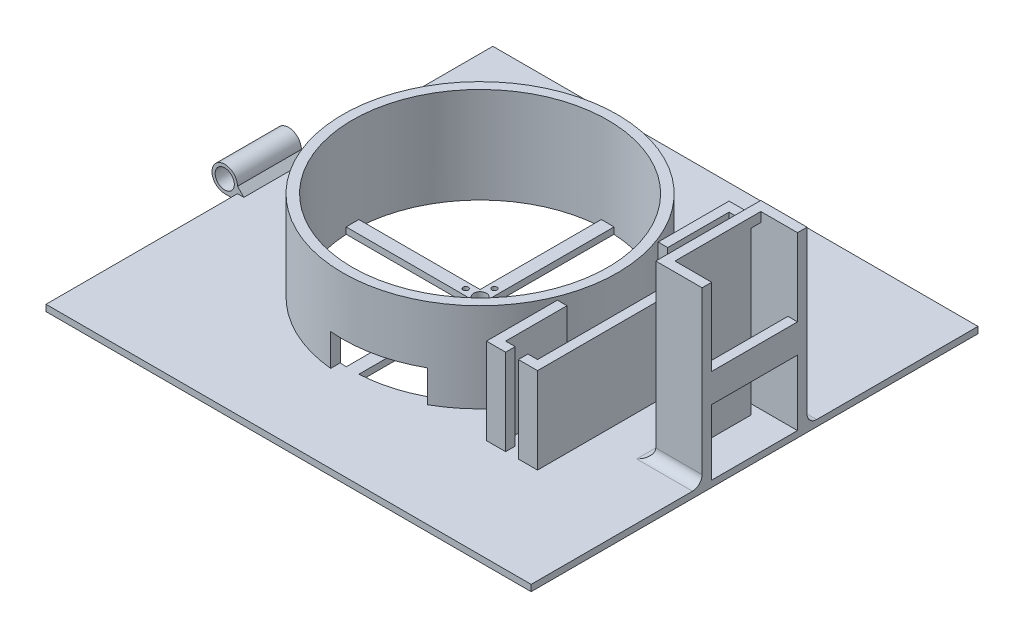
from build123d import *

# Parameters (mm, degrees)
CROQUIS1_R                 = 43
CROQUIS1_R_2               = 40
SALIENTE_EXTRUIR1_DEPTH    = 30
CROQUIS3_R                 = 0.81
CROQUIS3_R_2               = 2
SALIENTE_EXTRUIR2_DEPTH    = 2
CROQUIS4_W                 = 152
CROQUIS4_H                 = 140
CROQUIS4_R                 = 43
SALIENTE_EXTRUIR3_DEPTH    = 2
SALIENTE_EXTRUIR17_DEPTH   = 27
SALIENTE_EXTRUIR17_2_DEPTH = 27
SALIENTE_EXTRUIR17_3_DEPTH = 27
CORTAR_EXTRUIR1_REACH      = 169.021
CORTAR_EXTRUIR1_END_RADIUS = 40
CROQUIS15_W                = 25
CROQUIS15_H                = 10
SALIENTE_EXTRUIR19_START   = -60
CROQUIS18_R                = 4
CROQUIS18_R_2              = 3
SALIENTE_EXTRUIR19_DEPTH   = 20
CROQUIS19_W                = 14.5
CROQUIS19_H                = 3
CROQUIS19_W_2              = 3
CROQUIS19_H_2              = 20.9
SALIENTE_EXTRUIR20_DEPTH   = 53.7
SALIENTE_EXTRUIR21_REACH   = 134.145
CROQUIS20_W                = 3
CROQUIS20_H                = 3
CROQUIS20_H_2              = 9
SALIENTE_EXTRUIR22_START   = 23.9
CROQUIS20_2_W              = 3
CROQUIS20_2_H              = 3
SALIENTE_EXTRUIR22_DEPTH   = 3
REDONDEO1_R                = 3


with BuildPart() as part:
    # Croquis1 → Saliente-Extruir1 (new body)
    with BuildSketch(Plane(origin=(0, 0, 0), x_dir=(1, 0, 0), z_dir=(0, 1, 0))):
        with Locations(Location((0, 0, 0), (0, 0, 270))):
            Circle(CROQUIS1_R)
        with Locations(Location((0, 0, 0), (0, 0, 270))):
            Circle(CROQUIS1_R_2, mode=Mode.SUBTRACT)
    extrude(amount=SALIENTE_EXTRUIR1_DEPTH)

    # Croquis3 → Saliente-Extruir2 (add)
    with BuildSketch(Plane(origin=(0, 0, 0), x_dir=(1, 0, 0), z_dir=(0, 1, 0))):
        with BuildLine():
            Line((-2, 39.949968711), (-2, 2))
            Line((-2, 2), (-39.949968711, 2))
            ThreePointArc((-39.949968711, 2), (-40, 0), (-39.949968711, -2))
            Line((-39.949968711, -2), (-2, -2))
            Line((-2, -2), (-2, -39.949968711))
            ThreePointArc((-2, -39.949968711), (0, -40), (2, -39.949968711))
            Line((2, -39.949968711), (2, -2))
            Line((2, -2), (39.949968711, -2))
            ThreePointArc((39.949968711, -2), (39.987490222, -1.000312842), (40, 0))
            ThreePointArc((40, 0), (39.987490222, 1.000312842), (39.949968711, 2))
            Line((39.949968711, 2), (2, 2))
            Line((2, 2), (2, 39.949968711))
            ThreePointArc((2, 39.949968711), (0, 40), (-2, 39.949968711))
        make_face()
        with Locations(Location((0, -4.5, 0), (0, 0, 270))):
            Circle(CROQUIS3_R, mode=Mode.SUBTRACT)
        with Locations(Location((-4.5, 0, 0), (0, 0, 270))):
            Circle(CROQUIS3_R, mode=Mode.SUBTRACT)
        with Locations(Location((0, 0, 0), (0, 0, 270))):
            Circle(CROQUIS3_R_2, mode=Mode.SUBTRACT)
        with Locations(Location((4.5, 0, 0), (0, 0, 270))):
            Circle(CROQUIS3_R, mode=Mode.SUBTRACT)
        with Locations(Location((0, 4.5, 0), (0, 0, 270))):
            Circle(CROQUIS3_R, mode=Mode.SUBTRACT)
    extrude(amount=SALIENTE_EXTRUIR2_DEPTH)

    # Croquis4 → Saliente-Extruir3 (add)
    with BuildSketch(Plane(origin=(0, 0, 0), x_dir=(1, 0, 0), z_dir=(0, 1, 0))):
        with Locations((10, 0)):
            Rectangle(CROQUIS4_W, CROQUIS4_H)
        with Locations(Location((0, 0, 0), (0, 0, 90))):
            Circle(CROQUIS4_R, mode=Mode.SUBTRACT)
    extrude(amount=SALIENTE_EXTRUIR3_DEPTH)

    # Cortar-Extruir1: up to this cylinder (the profile starts outside it)
    cortar_extruir1_end = Plane(origin=(0, 7, 0), z_dir=(0, -1, 0)) * Cylinder(CORTAR_EXTRUIR1_END_RADIUS, 419.042, mode=Mode.PRIVATE)
    # Croquis15 → Cortar-Extruir1 (cut, up to the surface)
    with BuildSketch(Plane.XY.offset(70), mode=Mode.PRIVATE) as cortar_extruir1_sk1:
        with Locations((8.5, 7)):
            Rectangle(CROQUIS15_W, CROQUIS15_H)
    cortar_extruir1_tool1 = extrude(cortar_extruir1_sk1.sketch, amount=-CORTAR_EXTRUIR1_REACH, mode=Mode.PRIVATE) - cortar_extruir1_end
    add(cortar_extruir1_tool1.solids().sort_by_distance((8.5, 7, 70))[0], mode=Mode.SUBTRACT)

    # Croquis19 → Saliente-Extruir20 (add)
    with BuildSketch(Plane(origin=(0, 2, 0), x_dir=(1, 0, 0), z_dir=(0, 1, 0))):
        with Locations((78.75, 14.95)):
            Rectangle(CROQUIS19_W, CROQUIS19_H)
        with Locations((78.75, -14.95)):
            Rectangle(CROQUIS19_W, CROQUIS19_H)
        with Locations((73, 0)):
            Rectangle(CROQUIS19_W_2, CROQUIS19_H_2)
    extrude(amount=SALIENTE_EXTRUIR20_DEPTH)

    # Croquis20 → Saliente-Extruir21 (add, up to next)
    with BuildSketch(Plane.XY.offset(-13.45), mode=Mode.PRIVATE) as saliente_extruir21_sk1:
        with Locations((73, 54.2)):
            Rectangle(CROQUIS20_W, CROQUIS20_H)
    saliente_extruir21_tool1 = extrude(saliente_extruir21_sk1.sketch, amount=SALIENTE_EXTRUIR21_REACH, mode=Mode.PRIVATE) - part.part
    # Croquis20 → Saliente-Extruir21 (add, up to next)
    with BuildSketch(Plane.XY.offset(-13.45), mode=Mode.PRIVATE) as saliente_extruir21_sk2:
        with Locations((84.5, 27)):
            Rectangle(CROQUIS20_W, CROQUIS20_H_2)
    saliente_extruir21_tool2 = extrude(saliente_extruir21_sk2.sketch, amount=SALIENTE_EXTRUIR21_REACH, mode=Mode.PRIVATE) - part.part
    add(saliente_extruir21_tool1.solids().sort_by_distance((73, 54.2, -13.45))[0])
    add(saliente_extruir21_tool2.solids().sort_by_distance((84.5, 27, -13.45))[0])

    # Croquis20<2> → Saliente-Extruir22 (add)
    with BuildSketch(Plane.XY.offset(-13.45).offset(SALIENTE_EXTRUIR22_START)):
        with Locations((73, 54.2)):
            Rectangle(CROQUIS20_2_W, CROQUIS20_2_H)
    extrude(amount=SALIENTE_EXTRUIR22_DEPTH)

    # Redondeo1
    redondeo1_edges = [part.edges().sort_by_distance(p)[0] for p in [
        (78.75, 2, -16.45),
        (71.5, 2, -14.95),
        (71.5, 2, 0),
        (71.5, 2, 14.95),
        (78.75, 2, 16.45),
    ]]
    fillet(redondeo1_edges, radius=REDONDEO1_R)


with BuildPart() as body_2:
    # Croquis14 → Saliente-Extruir17 (new body)
    with BuildSketch(Plane(origin=(0, 2, 0), x_dir=(1, 0, 0), z_dir=(0, 1, 0))):
        Polygon((43, -15.779733838), (40, -15.779733838), (40, -38), (46, -38), (46, -35), (43, -35), align=None)
    extrude(amount=SALIENTE_EXTRUIR17_DEPTH)


with BuildPart() as body_3:
    # Croquis14 → Saliente-Extruir17 2 (new body)
    with BuildSketch(Plane(origin=(0, 2, 0), x_dir=(1, 0, 0), z_dir=(0, 1, 0))):
        Polygon((56, -38), (56, 38), (49.998935995, 38), (49.998935995, 35), (53, 35), (53, -35), (49.998935995, -35), (49.998935995, -38), align=None)
    extrude(amount=SALIENTE_EXTRUIR17_2_DEPTH)


with BuildPart() as body_4:
    # Croquis14 → Saliente-Extruir17 3 (new body)
    with BuildSketch(Plane(origin=(0, 2, 0), x_dir=(1, 0, 0), z_dir=(0, 1, 0))):
        Polygon((40, 38), (40, 15.779733838), (43, 15.779733838), (43, 35), (46, 35), (46, 38), align=None)
    extrude(amount=SALIENTE_EXTRUIR17_3_DEPTH)


with BuildPart() as body_5:
    # Croquis18 → Saliente-Extruir19 (new body)
    # profile 1 of 2: a face of its own
    with BuildSketch(Plane.XY.offset(70).offset(SALIENTE_EXTRUIR19_START)):
        with BuildLine():
            Line((-66, 0), (-66, 2))
            Line((-66, 2), (-64, 2))
            Line((-64, 2), (-66, 4))
            ThreePointArc((-66, 4), (-67.171572875, 1.171572875), (-70, 0))
            Line((-70, 0), (-66, 0))
        make_face()
    # profile 2 of 2: a face of its own
    with BuildSketch(Plane.XY.offset(70).offset(SALIENTE_EXTRUIR19_START)):
        with Locations((-70, 4)):
            Circle(CROQUIS18_R)
        with Locations((-70, 4)):
            Circle(CROQUIS18_R_2, mode=Mode.SUBTRACT)
    extrude(amount=-SALIENTE_EXTRUIR19_DEPTH)


solid = Compound([part.part, body_2.part, body_3.part, body_4.part, body_5.part])
